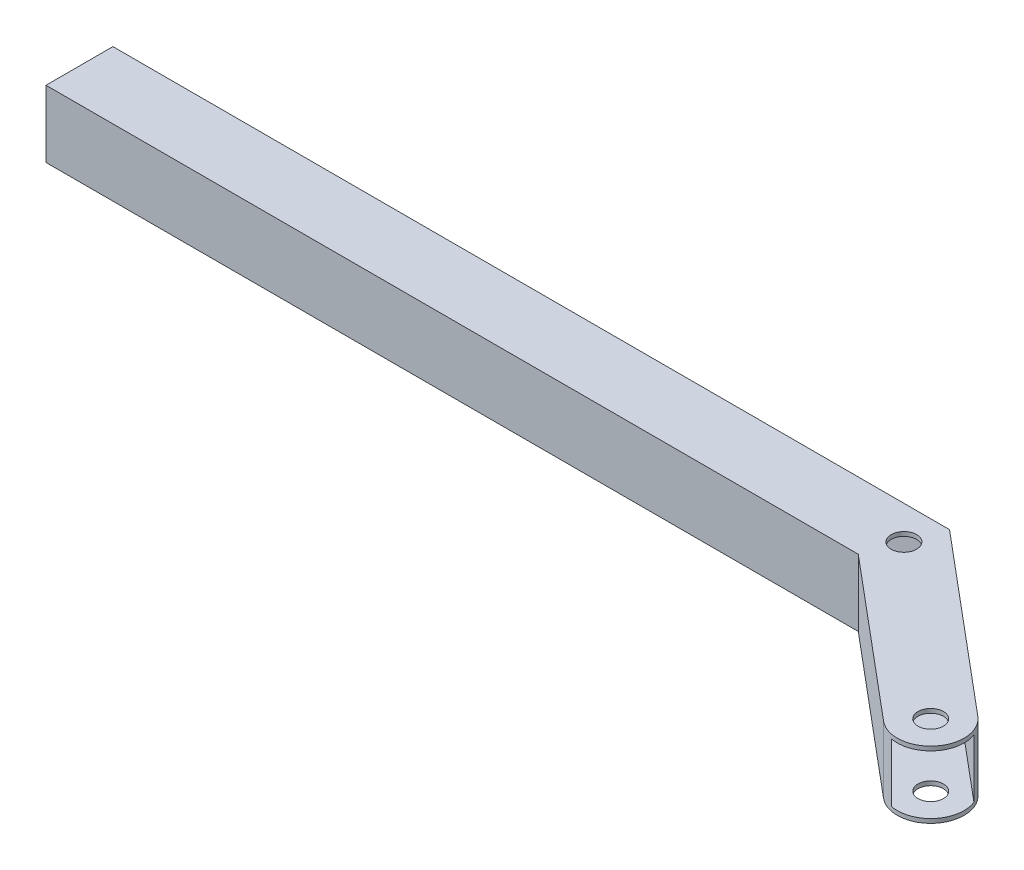
from build123d import *

# Parameters (mm, degrees)
BOSS_EXTRUDE1_DEPTH = 1.5875
BOSS_EXTRUDE2_DEPTH = 22.225
BOSS_EXTRUDE3_DEPTH = 22.225
BOSS_EXTRUDE4_DEPTH = 1.5875
HOLE1_OUTLINE_R     = 4.826
HOLE1_DEPTH         = 25.4
HOLE2_OUTLINE_R     = 4.826
HOLE2_DEPTH         = 25.4


# Read off the part's stored shape, not the designer's step: Hole1, Hole2
with BuildPart() as part:
    # Sketch4 → Boss-Extrude1 (new body)
    with BuildSketch(Plane(origin=(0, 0, 0), x_dir=(1, 0, 0), z_dir=(0, 1, 0))):
        with BuildLine():
            Line((121.523565154, 38.695091361), (-186.782012798, 38.695091361))
            Line((-186.782012798, 38.695091361), (-186.782012798, 64.095091361))
            Line((-186.782012798, 64.095091361), (130.76840925, 64.095091361))
            Line((130.76840925, 64.095091361), (197.546358654, 8.061738645))
            ThreePointArc((197.546358654, 8.061738645), (199.111720445, -9.830428491), (181.219553308, -11.395790282))
            Line((181.219553308, -11.395790282), (121.523565154, 38.695091361))
        make_face()
    extrude(amount=BOSS_EXTRUDE1_DEPTH)

    # Sketch5 → Boss-Extrude2 (add)
    with BuildSketch(Plane(origin=(0, 1.5875, 0), x_dir=(1, 0, 0), z_dir=(0, 1, 0))):
        with BuildLine():
            Line((-186.782012798, 64.095091361), (-186.782012798, 62.507591361))
            Line((-186.782012798, 62.507591361), (129.436338508, 62.507591361))
            Line((129.436338508, 62.507591361), (129.74798387, 62.878995842))
            Line((129.74798387, 62.878995842), (130.190606494, 62.507591361))
            Line((130.190606494, 62.507591361), (130.768409293, 62.507591361))
            Line((130.768409293, 62.507591361), (130.768409293, 62.022757246))
            Line((130.768409293, 62.022757246), (201.235851163, 2.893552762))
            ThreePointArc((201.235851163, 2.893552762), (199.719327747, 5.7119592), (197.546358654, 8.061738645))
            Line((197.546358654, 8.061738645), (130.76840925, 64.095091361))
            Line((130.76840925, 64.095091361), (-186.782012798, 64.095091361))
        make_face()
    extrude(amount=BOSS_EXTRUDE2_DEPTH)

    # Sketch7 → Boss-Extrude3 (add)
    with BuildSketch(Plane(origin=(0, 1.5875, 0), x_dir=(1, 0, 0), z_dir=(0, 1, 0))):
        with BuildLine():
            Line((-186.782012798, 38.695091361), (-186.782012798, 40.282591361))
            Line((-186.782012798, 40.282591361), (122.10136791, 40.282591361))
            Line((122.10136791, 40.282591361), (186.949896399, -14.131784976))
            ThreePointArc((186.949896399, -14.131784976), (183.910966405, -13.127712138), (181.219553308, -11.395790282))
            Line((181.219553308, -11.395790282), (121.523565154, 38.695091361))
            Line((121.523565154, 38.695091361), (-186.782012798, 38.695091361))
        make_face()
    extrude(amount=BOSS_EXTRUDE3_DEPTH)

    # Sketch8 → Boss-Extrude4 (add)
    with BuildSketch(Plane(origin=(0, 23.8125, 0), x_dir=(1, 0, 0), z_dir=(0, 1, 0))):
        with BuildLine():
            Line((121.523565154, 38.695091361), (-186.782012798, 38.695091361))
            Line((-186.782012798, 38.695091361), (-186.782012798, 64.095091361))
            Line((-186.782012798, 64.095091361), (130.76840925, 64.095091361))
            Line((130.76840925, 64.095091361), (197.546358654, 8.061738645))
            ThreePointArc((197.546358654, 8.061738645), (199.111720445, -9.830428491), (181.219553308, -11.395790282))
            Line((181.219553308, -11.395790282), (121.523565154, 38.695091361))
        make_face()
    extrude(amount=BOSS_EXTRUDE4_DEPTH)

    # Hole1 outline → Hole1 (cut)
    with BuildSketch(Plane(origin=(0, 0, 0), x_dir=(1, 0, 0), z_dir=(0, 1, 0))):
        with Locations((189.382955981, -1.667025818)):
            Circle(HOLE1_OUTLINE_R)
    extrude(amount=HOLE1_DEPTH, mode=Mode.SUBTRACT)

    # Hole2 outline → Hole2 (cut)
    with BuildSketch(Plane(origin=(0, 0, 0), x_dir=(1, 0, 0), z_dir=(0, 1, 0))):
        with Locations((126.145987202, 51.395091361)):
            Circle(HOLE2_OUTLINE_R)
    extrude(amount=HOLE2_DEPTH, mode=Mode.SUBTRACT)


solid = part.part
